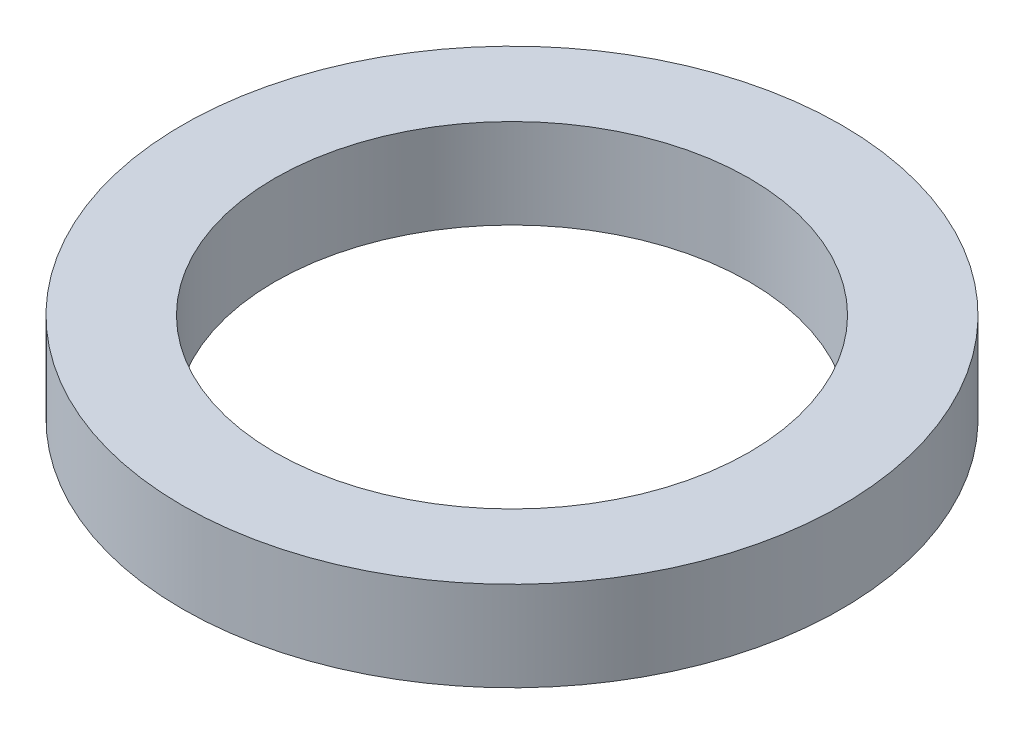
from build123d import *

# Parameters (mm, degrees)
SKETCH1_R           = 62.5
BOSS_EXTRUDE1_DEPTH = 17
SKETCH2_R           = 45
CUT_EXTRUDE1_DEPTH  = 91.008332948


with BuildPart() as part:
    # Sketch1 → Boss-Extrude1 (new body)
    with BuildSketch(Plane(origin=(0, 0, 0), x_dir=(1, 0, 0), z_dir=(0, 1, 0))):
        Circle(SKETCH1_R)
    extrude(amount=BOSS_EXTRUDE1_DEPTH)

    # Sketch2 → Cut-Extrude1 (cut, through all)
    with BuildSketch(Plane(origin=(0, 0, 0), x_dir=(1, 0, 0), z_dir=(0, 1, 0))):
        Circle(SKETCH2_R)
    extrude(amount=CUT_EXTRUDE1_DEPTH, mode=Mode.SUBTRACT)


solid = part.part
